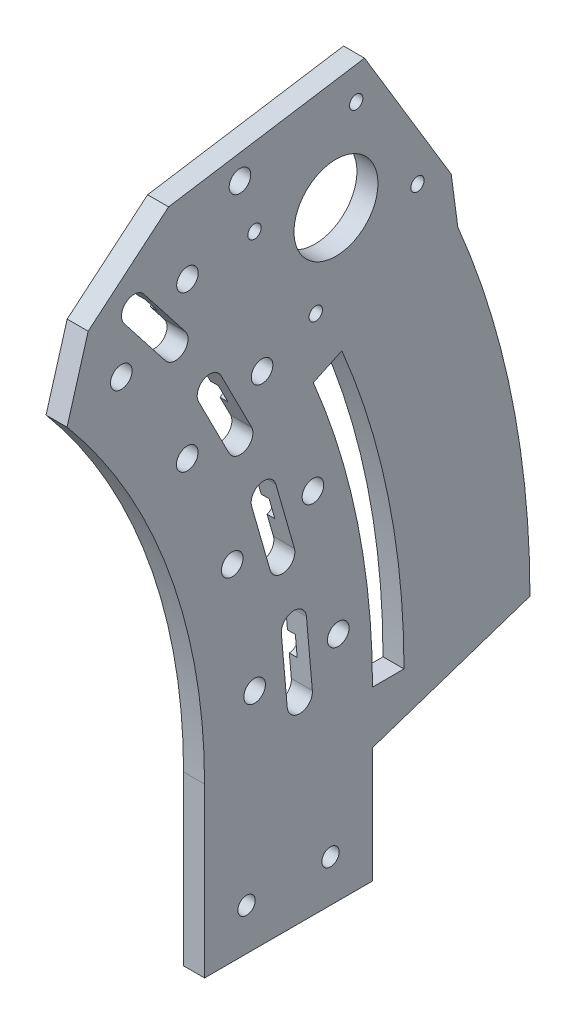
from build123d import *

# Parameters (mm, degrees)
SKETCH1_R           = 2.6289
SKETCH1_R_2         = 2.0193
SKETCH1_R_3         = 12.7
BOSS_EXTRUDE1_DEPTH = 6.35
SKETCH8_R           = 3.2639
CUT_EXTRUDE1_DEPTH  = 323.314421397
CUT_EXTRUDE2_START  = -2.38125
SKETCH9_R           = 3.175
CUT_EXTRUDE2_DEPTH  = 12.41425
CIRPATTERN1_COUNT   = 4
CIRPATTERN1_ANGLE   = 33
SKETCH10_R          = 3.2639
CUT_EXTRUDE3_DEPTH  = 323.314421397


with BuildPart() as part:
    # Sketch1 → Boss-Extrude1 (new body)
    with BuildSketch(Plane(origin=(0, 0, 0), x_dir=(0, 0, -1), z_dir=(1, 0, 0))):
        with BuildLine():
            ThreePointArc((136.202701987, 114.287637002), (167.077347976, 60.811181483), (177.8, 0))
            Line((177.8, 0), (177.8, -50.8))
            Line((177.8, -50.8), (228.6, -50.8))
            Line((228.6, -50.8), (228.6, -15.875))
            Line((228.6, -15.875), (276.225, 0))
            ThreePointArc((276.225, 0), (270.718798765, 54.877888266), (254.419713581, 107.567931867))
            Line((254.419713581, 107.567931867), (252.414427317, 122.460103226))
            Line((252.414427317, 122.460103226), (239.303971884, 144.215009761))
            Line((239.303971884, 144.215009761), (226.193516451, 165.969916296))
            Line((226.193516451, 165.969916296), (199.106443854, 161.707420029))
            Line((199.106443854, 161.707420029), (166.921891726, 156.642770358))
            Line((166.921891726, 156.642770358), (142.599980657, 136.23426375))
            Line((142.599980657, 136.23426375), (136.202701987, 114.287637002))
        make_face()
        with Locations((190.5, -38.1)):
            Circle(SKETCH1_R, mode=Mode.SUBTRACT)
        with Locations((215.9, -38.1)):
            Circle(SKETCH1_R, mode=Mode.SUBTRACT)
        with BuildLine():
            Line((210.688820135, 88.702768109), (219.327339294, 92.730975748))
            ThreePointArc((219.327339294, 92.730975748), (233.378274797, 47.308524367), (238.125, 0))
            Line((238.125, 0), (228.6, 0))
            ThreePointArc((228.6, 0), (224.077469062, 45.246523166), (210.688820135, 88.702768109))
        make_face(mode=Mode.SUBTRACT)
        with Locations((192.895531473, 137.217104322)):
            Circle(SKETCH1_R_2, mode=Mode.SUBTRACT)
        with Locations((211.436515355, 106.451020453)):
            Circle(SKETCH1_R_2, mode=Mode.SUBTRACT)
        with Locations((217.549065349, 131.104554328)):
            Circle(SKETCH1_R_3, mode=Mode.SUBTRACT)
        with Locations((223.661615343, 155.758088204)):
            Circle(SKETCH1_R_2, mode=Mode.SUBTRACT)
        with Locations((242.202599225, 124.992004335)):
            Circle(SKETCH1_R_2, mode=Mode.SUBTRACT)
    extrude(amount=BOSS_EXTRUDE1_DEPTH)

    # Sketch8 → Cut-Extrude1 (cut, through all)
    with BuildSketch(Plane.ZY):
        with Locations((-218.241353484, 19.093644342)):
            Circle(SKETCH8_R)
        with Locations((-192.938008153, 16.879888477)):
            Circle(SKETCH8_R)
        with Locations((-210.588406038, 60.385253726)):
            Circle(SKETCH8_R)
        with Locations((-186.172358961, 53.384064888)):
            Circle(SKETCH8_R)
        with Locations((-195.197254287, 99.45796873)):
            Circle(SKETCH8_R)
        with Locations((-172.565688572, 87.926610037)):
            Circle(SKETCH8_R)
        with Locations((-172.633455846, 134.876037707)):
            Circle(SKETCH8_R)
        with Locations((-152.617982705, 119.238236234)):
            Circle(SKETCH8_R)
        with BuildLine():
            Line((-201.035193399, 27.787109942), (-202.806198092, 7.544433676))
            ThreePointArc((-202.806198092, 7.544433676), (-206.933763272, 4.080995257), (-210.397201691, 8.208560436))
            Line((-210.397201691, 8.208560436), (-208.626196999, 28.451236701))
            ThreePointArc((-208.626196999, 28.451236701), (-204.498631819, 31.914675121), (-201.035193399, 27.787109942))
        make_face()
        with BuildLine():
            Line((-192.039580138, 65.635905756), (-197.640531208, 46.103068095))
            ThreePointArc((-197.640531208, 46.103068095), (-202.353116595, 43.490839359), (-204.965345331, 48.203424746))
            Line((-204.965345331, 48.203424746), (-199.364394261, 67.736262407))
            ThreePointArc((-199.364394261, 67.736262407), (-194.651808874, 70.348491143), (-192.039580138, 65.635905756))
        make_face()
        with BuildLine():
            Line((-182.776820638, 104.532276267), (-192.001907592, 86.427023695))
            ThreePointArc((-192.001907592, 86.427023695), (-190.336876539, 81.302585034), (-185.212437878, 82.967616087))
            Line((-185.212437878, 82.967616087), (-175.987350923, 101.072868659))
            ThreePointArc((-175.987350923, 101.072868659), (-177.652381977, 106.19730732), (-182.776820638, 104.532276267))
        make_face()
        with BuildLine():
            Line((-159.472997023, 137.487185455), (-171.983238202, 121.474806942))
            ThreePointArc((-171.983238202, 121.474806942), (-171.326587452, 116.12681575), (-165.978596259, 116.7834665))
            Line((-165.978596259, 116.7834665), (-153.468355081, 132.795845013))
            ThreePointArc((-153.468355081, 132.795845013), (-154.125005831, 138.143836206), (-159.472997023, 137.487185455))
        make_face()
    extrude(amount=-CUT_EXTRUDE1_DEPTH, mode=Mode.SUBTRACT)

    # Sketch9 → Cut-Extrude2 (cut)
    with BuildSketch(Plane(origin=(0, 18.329898569, -209.511699345), x_dir=(0, -0.08715574274765739, 0.9961946980917457), z_dir=(-1, 0, 0)).offset(CUT_EXTRUDE2_START)):
        Circle(SKETCH9_R)
        with Locations((7.62, 0)):
            Circle(SKETCH9_R)
    cut_extrude2 = extrude(amount=CUT_EXTRUDE2_DEPTH, mode=Mode.SUBTRACT)

    # CirPattern1: Cut-Extrude2 ×4 about axis
    cirpattern1_axis = Axis((0, 0, 0), (1, 0, 0))
    for i in range(1, CIRPATTERN1_COUNT):
        add(cut_extrude2.rotate(cirpattern1_axis, i * CIRPATTERN1_ANGLE / (CIRPATTERN1_COUNT - 1)), mode=Mode.SUBTRACT)

    # Sketch10 → Cut-Extrude3 (cut, through all)
    with BuildSketch(Plane.ZY):
        with Locations((-188.512295871, 152.654247257)):
            Circle(SKETCH10_R)
    extrude(amount=-CUT_EXTRUDE3_DEPTH, mode=Mode.SUBTRACT)


solid = part.part
